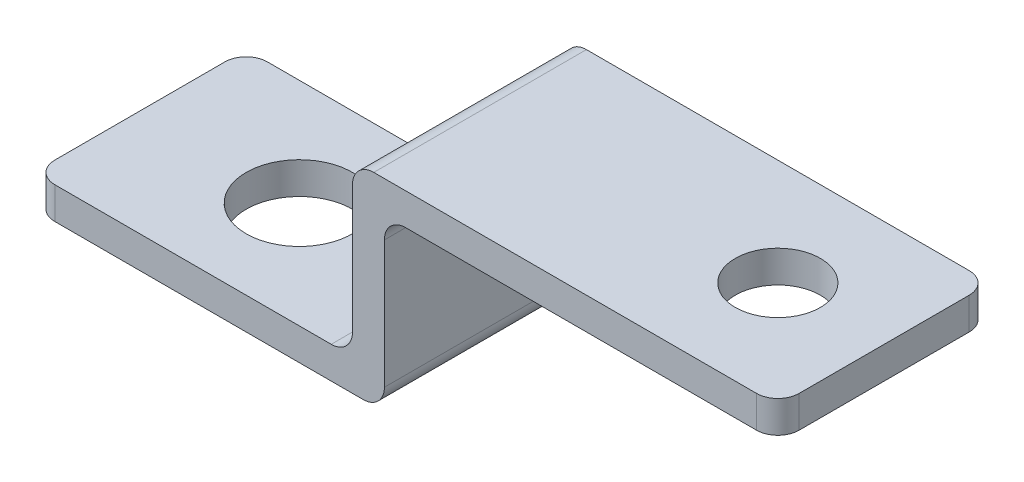
from build123d import *

# Parameters (mm, degrees)
EXTRUDE_THIN1_DEPTH = 10
SKETCH2_R           = 2
SKETCH2_R_2         = 2.5
CUT_EXTRUDE1_DEPTH  = 38.619808612
FILLET2_R           = 1


with BuildPart() as part:
    # Sketch1 → Extrude-Thin1 (new body)
    with BuildSketch(Plane.XY):
        Polygon((0, 0), (15, 0), (15, 8), (35, 8), (35, 6.5), (16.5, 6.5), (16.5, -1.5), (0, -1.5), align=None)
    extrude(amount=EXTRUDE_THIN1_DEPTH)

    # Sketch2 → Cut-Extrude1 (cut, through all)
    with BuildSketch(Plane(origin=(0, 8, 0), x_dir=(1, 0, 0), z_dir=(0, 1, 0))):
        with Locations((30, -5)):
            Circle(SKETCH2_R)
        with Locations((7.5, -5)):
            Circle(SKETCH2_R_2)
    extrude(amount=-CUT_EXTRUDE1_DEPTH, mode=Mode.SUBTRACT)

    # Fillet2
    fillet2_edges = [part.edges().sort_by_distance(p)[0] for p in [
        (15, 0, 5),
        (16.5, 6.5, 5),
        (15, 8, 5),
        (16.5, -1.5, 5),
        (35, 7.25, 10),
        (35, 7.25, 0),
        (0, -0.75, 10),
        (0, -0.75, 0),
    ]]
    fillet(fillet2_edges, radius=FILLET2_R)


solid = part.part
